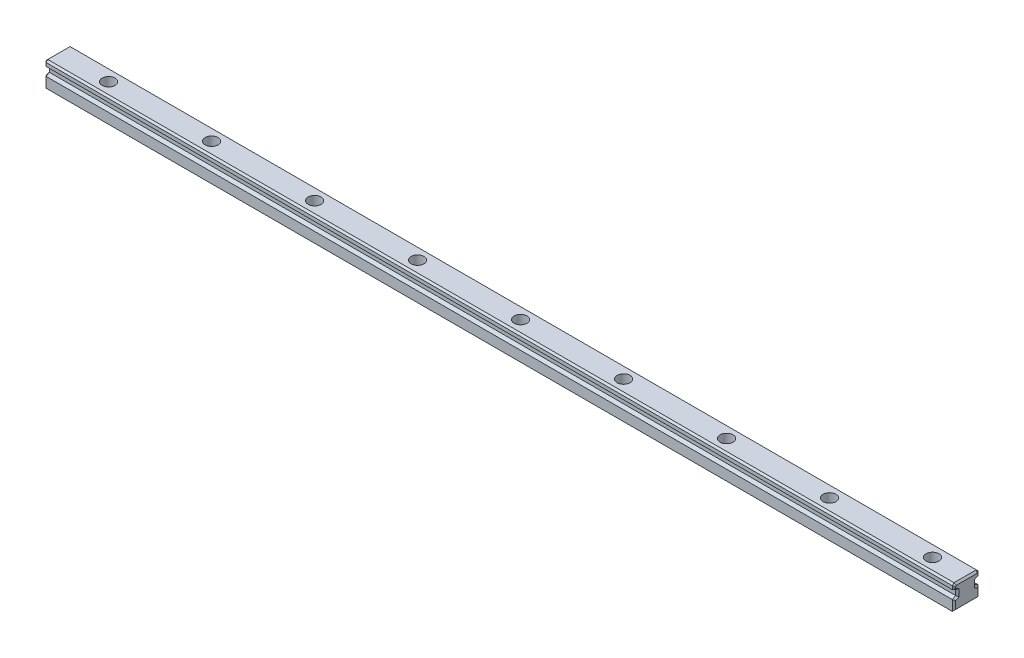
from build123d import *

# Parameters (mm, degrees)
BOSS_EXTRUDE1_DEPTH = 530
CHAMFER1_SIZE       = 1
CHAMFER2_SIZE       = 1
SKETCH2_R           = 3.75
CUT_EXTRUDE1_DEPTH  = 5.3
SKETCH3_R           = 2.25
CUT_EXTRUDE2_DEPTH  = 531.124457085
LPATTERN1_COUNT     = 67
LPATTERN1_PITCH     = 60


with BuildPart() as part:
    # Sketch1 → Boss-Extrude1 (new body)
    with BuildSketch(Plane(origin=(0, 0, 0), x_dir=(0, 0, -1), z_dir=(1, 0, 0))):
        Polygon((-7.5, 0), (7.5, 0), (7.5, 6), (5.5, 7), (5.5, 10), (7.5, 11), (7.5, 13), (6.5, 14), (-6.5, 14), (-7.5, 13), (-7.5, 11), (-5.5, 10), (-5.5, 7), (-7.5, 6), align=None)
    extrude(amount=BOSS_EXTRUDE1_DEPTH)

    # Chamfer1
    chamfer1_edges = [part.edges().sort_by_distance(p)[0] for p in [
        (0, 0, 0),
        (0, 3, -7.5),
        (0, 6.5, -6.5),
        (0, 8.5, -5.5),
        (0, 10.5, -6.5),
        (0, 12, -7.5),
        (0, 13.5, -7),
        (0, 14, 0),
        (0, 13.5, 7),
        (0, 12, 7.5),
        (0, 10.5, 6.5),
        (0, 8.5, 5.5),
        (0, 6.5, 6.5),
        (0, 3, 7.5),
    ]]
    chamfer(chamfer1_edges, length=CHAMFER1_SIZE)

    # Chamfer2
    chamfer2_edges = [part.edges().sort_by_distance(p)[0] for p in [
        (530, 6.5, 6.5),
        (530, 8.5, 5.5),
        (530, 10.5, 6.5),
        (530, 12, 7.5),
        (530, 13.5, 7),
        (530, 14, 0),
        (530, 13.5, -7),
        (530, 12, -7.5),
        (530, 10.5, -6.5),
        (530, 8.5, -5.5),
        (530, 6.5, -6.5),
        (530, 3, -7.5),
        (530, 0, 0),
        (530, 3, 7.5),
    ]]
    chamfer(chamfer2_edges, length=CHAMFER2_SIZE)

    # Sketch2 → Cut-Extrude1 (cut)
    with BuildSketch(Plane(origin=(0, 14, 0), x_dir=(1, 0, 0), z_dir=(0, 1, 0))):
        with Locations((510, 0)):
            Circle(SKETCH2_R)
    cut_extrude1 = extrude(amount=-CUT_EXTRUDE1_DEPTH, mode=Mode.SUBTRACT)

    # Sketch3 → Cut-Extrude2 (cut, through all)
    with BuildSketch(Plane(origin=(0, 8.7, 0), x_dir=(1, 0, 0), z_dir=(0, 1, 0))):
        with Locations((510, 0)):
            Circle(SKETCH3_R)
    cut_extrude2 = extrude(amount=-CUT_EXTRUDE2_DEPTH, mode=Mode.SUBTRACT)

    # LPattern1: Cut-Extrude1, Cut-Extrude2 ×67
    with Locations(*[(-i * LPATTERN1_PITCH, 0, 0) for i in range(1, LPATTERN1_COUNT)]):
        add(cut_extrude1, mode=Mode.SUBTRACT)
        add(cut_extrude2, mode=Mode.SUBTRACT)


solid = part.part
